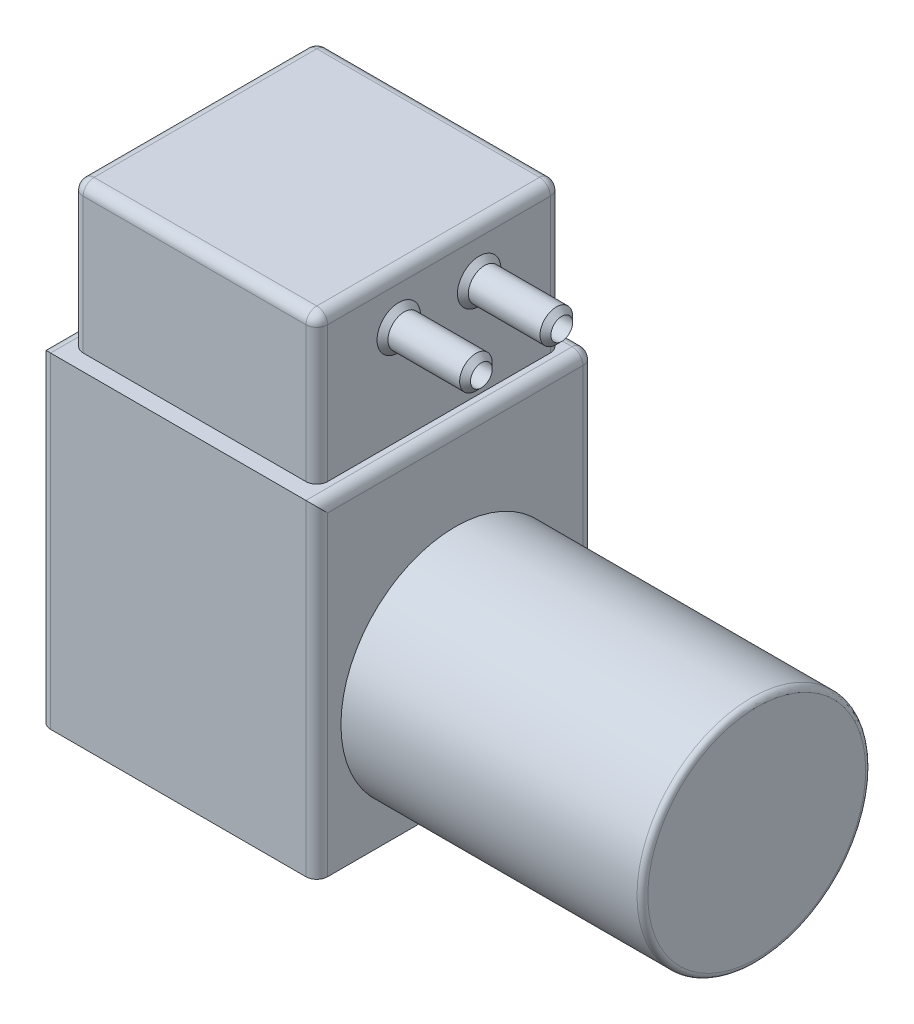
from build123d import *

# Parameters (mm, degrees)
ESQUISSE1_W        = 51
ESQUISSE1_H        = 51
BOSS_EXTRU_1_DEPTH = 60
ESQUISSE2_W        = 45
ESQUISSE2_H        = 45
BOSS_EXTRU_2_DEPTH = 27
ESQUISSE3_R        = 21.05
BOSS_EXTRU_3_DEPTH = 55.5
ESQUISSE4_R        = 4
BOSS_EXTRU_4_DEPTH = 1
ESQUISSE5_R        = 3
ESQUISSE5_R_2      = 2
BOSS_EXTRU_5_DEPTH = 14.2
CHANFREIN1_SIZE    = 1
CONG_1_R           = 2
CONG_2_R           = 2
CONG_3_R           = 1


with BuildPart() as part:
    # Esquisse1 → Boss.-Extru.1 (new body)
    with BuildSketch(Plane(origin=(0, 0, 0), x_dir=(1, 0, 0), z_dir=(0, 1, 0))):
        with Locations((25.5, 25.5)):
            Rectangle(ESQUISSE1_W, ESQUISSE1_H)
    extrude(amount=BOSS_EXTRU_1_DEPTH)

    # Esquisse2 → Boss.-Extru.2 (add)
    with BuildSketch(Plane(origin=(0, 60, 0), x_dir=(1, 0, 0), z_dir=(0, 1, 0))):
        with Locations((25.5, 25.5)):
            Rectangle(ESQUISSE2_W, ESQUISSE2_H)
    extrude(amount=BOSS_EXTRU_2_DEPTH)

    # Esquisse3 → Boss.-Extru.3 (add)
    with BuildSketch(Plane(origin=(51, 0, 0), x_dir=(0, 0, -1), z_dir=(1, 0, 0))):
        with Locations(Location((25.5, 23, 0), (0, 0, 180))):
            Circle(ESQUISSE3_R)
    extrude(amount=BOSS_EXTRU_3_DEPTH)

    # Esquisse4 → Boss.-Extru.4 (add)
    with BuildSketch(Plane(origin=(48, 0, 0), x_dir=(0, 0, -1), z_dir=(1, 0, 0))):
        with Locations(Location((18.1, 78, 0), (0, 0, 180))):
            Circle(ESQUISSE4_R)
        with Locations(Location((32.9, 78, 0), (0, 0, 180))):
            Circle(ESQUISSE4_R)
    extrude(amount=BOSS_EXTRU_4_DEPTH)

    # Esquisse5 → Boss.-Extru.5 (add)
    # profile 1 of 2: a face of its own
    with BuildSketch(Plane(origin=(49, 0, 0), x_dir=(0, 0, -1), z_dir=(1, 0, 0))):
        with Locations((18.1, 78)):
            Circle(ESQUISSE5_R)
        with Locations((18.1, 78)):
            Circle(ESQUISSE5_R_2, mode=Mode.SUBTRACT)
    # profile 2 of 2: a face of its own
    with BuildSketch(Plane(origin=(49, 0, 0), x_dir=(0, 0, -1), z_dir=(1, 0, 0))):
        with Locations((32.9, 78)):
            Circle(ESQUISSE5_R)
        with Locations((32.9, 78)):
            Circle(ESQUISSE5_R_2, mode=Mode.SUBTRACT)
    extrude(amount=BOSS_EXTRU_5_DEPTH)

    # Chanfrein1
    chanfrein1_edges = [part.edges().sort_by_distance(p)[0] for p in [
        (49, 78, -22.1),
        (49, 78, -36.9),
        (63.2, 78, -15.1),
        (63.2, 78, -29.9),
    ]]
    chamfer(chanfrein1_edges, length=CHANFREIN1_SIZE - 0.0001)  # a hair under: the kernel refuses the full size

    # Congé1
    cong_1_edges = [part.edges().sort_by_distance(p)[0] for p in [
        (3, 73.5, -48),
        (3, 73.5, -3),
        (48, 73.5, -3),
        (48, 73.5, -48),
        (3, 87, -25.5),
        (25.5, 87, -3),
        (48, 87, -25.5),
        (25.5, 87, -48),
    ]]
    fillet(cong_1_edges, radius=CONG_1_R)

    # Congé2
    cong_2_edges = [part.edges().sort_by_distance(p)[0] for p in [
        (51, 60, -25.5),
        (25.5, 60, -51),
        (0, 60, -25.5),
        (0, 30, -51),
        (51, 30, -51),
        (51, 30, 0),
        (0, 30, 0),
    ]]
    fillet(cong_2_edges, radius=CONG_2_R)

    # Congé3
    cong_3_edges = [part.edges().sort_by_distance(p)[0] for p in [
        (106.5, 23, -46.55),
    ]]
    fillet(cong_3_edges, radius=CONG_3_R)


solid = part.part
